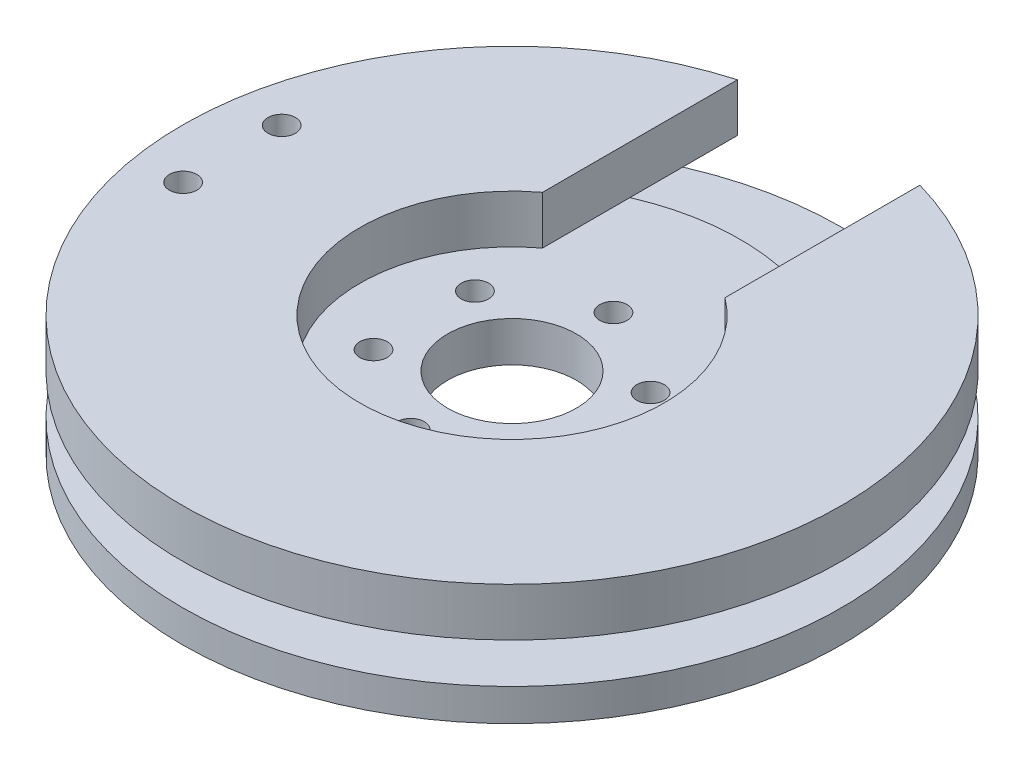
from build123d import *

# Parameters (mm, degrees)
SPINDLE_START                             = 4.7625
SKETCH6_R                                 = 22.5
SKETCH6_R_2                               = 6.35
SPINDLE_CENTER_DEPTH                      = 3.9624
LOWER_START                               = 8.7249
LOWER_FLANGE_DEPTH                        = 3.175
UPPER_FLANGE_DEPTH                        = 4.7625
F_6_32_TAPPED_HOLE1_D                     = 2.7051
CBORE_START                               = -11.8999
CBORE_FOR_6_SOCKET_HEAD_CAP_SCREW1_OUTL_R = 3.57251
CBORE_FOR_6_SOCKET_HEAD_CAP_SCREW1_DEPTH  = 3.175
F_6_32_TAPPED_HOLE3_D                     = 2.7051
F_6_32_TAPPED_HOLE3_DEPTH                 = 9.49
F_6_32_TAPPED_HOLE3_TIP                   = 0.81269403


# Read off the part's stored shape, not the designer's step: CBORE for #6 Socket Head Cap Screw1
with BuildPart() as part:
    # Sketch6 → Spindle Center (new body)
    with BuildSketch(Plane.XZ.offset(SPINDLE_START)):
        with Locations(Location((0, 0, 0), (0, 0, 90))):
            Circle(SKETCH6_R)
        with Locations(Location((0, 0, 0), (0, 0, 90))):
            Circle(SKETCH6_R_2, mode=Mode.SUBTRACT)
    extrude(amount=SPINDLE_CENTER_DEPTH)

    # Sketch6<3> → Lower Flange (add)
    with BuildSketch(Plane.XZ.offset(LOWER_START)):
        with BuildLine():
            Line((0, -32.5), (0, -22.5))
            ThreePointArc((0, -22.5), (-4.596966983, -22.025392041), (-9, -20.621590627))
            Line((-9, -20.621590627), (-9, -31.228992939))
            ThreePointArc((-9, -31.228992939), (-4.544652323, -32.180679534), (0, -32.5))
        make_face()
        with BuildLine():
            Line((-9, -31.228992939), (-9, -20.621590627))
            ThreePointArc((-9, -20.621590627), (-22.025392041, 4.596966983), (0, 22.5))
            Line((0, 22.5), (0, 32.5))
            ThreePointArc((0, 32.5), (-32.180679534, 4.544652323), (-9, -31.228992939))
        make_face()
        with BuildLine():
            ThreePointArc((22.5, 0), (18.824850597, -12.323757544), (9, -20.621590627))
            Line((9, -20.621590627), (9, -31.228992939))
            ThreePointArc((9, -31.228992939), (25.968731197, -19.541622246), (32.5, 0))
            ThreePointArc((32.5, 0), (22.980970389, 22.980970389), (0, 32.5))
            Line((0, 32.5), (0, 22.5))
            ThreePointArc((0, 22.5), (15.909902577, 15.909902577), (22.5, 0))
        make_face()
        with BuildLine():
            Line((9, -31.228992939), (9, -20.621590627))
            ThreePointArc((9, -20.621590627), (4.596966983, -22.025392041), (0, -22.5))
            Line((0, -22.5), (0, -32.5))
            ThreePointArc((0, -32.5), (4.544652323, -32.180679534), (9, -31.228992939))
        make_face()
        with BuildLine():
            ThreePointArc((15, 0), (13.416407865, -6.708203932), (9, -12))
            Line((9, -12), (9, -20.621590627))
            ThreePointArc((9, -20.621590627), (18.824850597, -12.323757544), (22.5, 0))
            ThreePointArc((22.5, 0), (15.909902577, 15.909902577), (0, 22.5))
            Line((0, 22.5), (0, 15))
            ThreePointArc((0, 15), (10.606601718, 10.606601718), (15, 0))
        make_face()
        with BuildLine():
            Line((9, -20.621590627), (9, -12))
            ThreePointArc((9, -12), (4.74341649, -14.230249471), (0, -15))
            Line((0, -15), (0, -22.5))
            ThreePointArc((0, -22.5), (4.596966983, -22.025392041), (9, -20.621590627))
        make_face()
        with BuildLine():
            Line((0, -22.5), (0, -15))
            ThreePointArc((0, -15), (-4.74341649, -14.230249471), (-9, -12))
            Line((-9, -12), (-9, -20.621590627))
            ThreePointArc((-9, -20.621590627), (-4.596966983, -22.025392041), (0, -22.5))
        make_face()
        with BuildLine():
            Line((-9, -20.621590627), (-9, -12))
            ThreePointArc((-9, -12), (-14.230249471, 4.74341649), (0, 15))
            Line((0, 15), (0, 22.5))
            ThreePointArc((0, 22.5), (-22.025392041, 4.596966983), (-9, -20.621590627))
        make_face()
    extrude(amount=LOWER_FLANGE_DEPTH)

    # Sketch6<4> → Upper Flange (add)
    with BuildSketch(Plane.XZ):
        with BuildLine():
            Line((9, -12), (9, -31.228992939))
            ThreePointArc((9, -31.228992939), (0, 32.5), (-9, -31.228992939))
            Line((-9, -31.228992939), (-9, -12))
            ThreePointArc((-9, -12), (0, 15), (9, -12))
        make_face()
    extrude(amount=UPPER_FLANGE_DEPTH)

    # #6-32 Tapped Hole1 (through all)
    with Locations(Plane(origin=(0, -8.7249, 10), x_dir=(0, 0, -1), z_dir=(0, -1, 0))):
        with Locations((0, 0), (15, -8.660254038), (15, 8.660254038), (5, -8.660254038), (20, 0), (5, 8.660254038)):
            Hole(F_6_32_TAPPED_HOLE1_D / 2)

    # CBORE for #6 Socket Head Cap Screw1 outl → CBORE for #6 Socket Head Cap Screw1 (cut)
    with BuildSketch(Plane(origin=(0, 0, 0), x_dir=(1, 0, 0), z_dir=(0, 1, 0)).offset(CBORE_START)):
        with Locations((-27.574617084, -4.862148975)):
            Circle(CBORE_FOR_6_SOCKET_HEAD_CAP_SCREW1_OUTL_R)
        with Locations((-27.574617084, 4.862148975)):
            Circle(CBORE_FOR_6_SOCKET_HEAD_CAP_SCREW1_OUTL_R)
    extrude(amount=CBORE_FOR_6_SOCKET_HEAD_CAP_SCREW1_DEPTH, mode=Mode.SUBTRACT)

    # #6-32 Tapped Hole3
    with Locations(Plane(origin=(-27.574617084, 0, 4.862148975), x_dir=(0, 0, 1), z_dir=(0, 1, 0))):
        with Locations((0, 0), (-9.72429795, 0)):
            Hole(F_6_32_TAPPED_HOLE3_D / 2, depth=F_6_32_TAPPED_HOLE3_DEPTH)
            with Locations((0, 0, -(F_6_32_TAPPED_HOLE3_DEPTH + F_6_32_TAPPED_HOLE3_TIP / 2))):  # 118° drill point
                Cone(0, F_6_32_TAPPED_HOLE3_D / 2, F_6_32_TAPPED_HOLE3_TIP, mode=Mode.SUBTRACT)


solid = part.part
